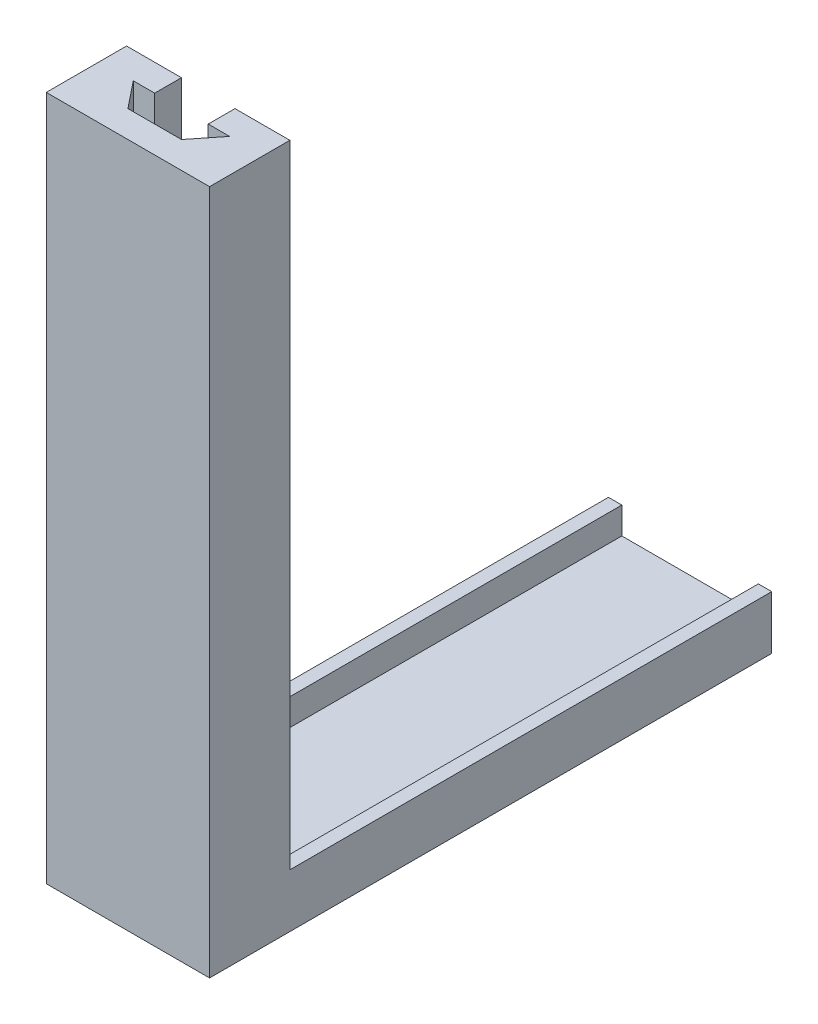
from build123d import *

# Parameters (mm, degrees)
SKETCH1_W           = 30.5
SKETCH1_H           = 105
BOSS_EXTRUDE1_DEPTH = 10
SKETCH2_W           = 30.5
SKETCH2_H           = 15
BOSS_EXTRUDE2_DEPTH = 118
SKETCH5_W           = 25.5
SKETCH5_H           = 90
CUT_EXTRUDE2_DEPTH  = 5
CUT_EXTRUDE3_DEPTH  = 123


with BuildPart() as part:
    # Sketch1 → Boss-Extrude1 (new body)
    with BuildSketch(Plane(origin=(0, 0, 0), x_dir=(1, 0, 0), z_dir=(0, 1, 0))):
        Rectangle(SKETCH1_W, SKETCH1_H)
    extrude(amount=BOSS_EXTRUDE1_DEPTH)

    # Sketch2 → Boss-Extrude2 (add)
    with BuildSketch(Plane(origin=(0, 10, 0), x_dir=(1, 0, 0), z_dir=(0, 1, 0))):
        with Locations((0, -45)):
            Rectangle(SKETCH2_W, SKETCH2_H)
    extrude(amount=BOSS_EXTRUDE2_DEPTH)

    # Sketch5 → Cut-Extrude2 (cut)
    with BuildSketch(Plane(origin=(0, 10, 0), x_dir=(1, 0, 0), z_dir=(0, 1, 0))):
        with Locations((0, 7.5)):
            Rectangle(SKETCH5_W, SKETCH5_H)
    extrude(amount=-CUT_EXTRUDE2_DEPTH, mode=Mode.SUBTRACT)

    # Sketch6 → Cut-Extrude3 (cut)
    with BuildSketch(Plane(origin=(0, 128, 0), x_dir=(1, 0, 0), z_dir=(0, 1, 0))):
        Polygon((-5, -37.5), (5, -37.5), (5, -42.5), (9, -42.5), (5, -47.5), (-5, -47.5), (-9, -42.5), (-5, -42.5), align=None)
    extrude(amount=-CUT_EXTRUDE3_DEPTH, mode=Mode.SUBTRACT)


solid = part.part
